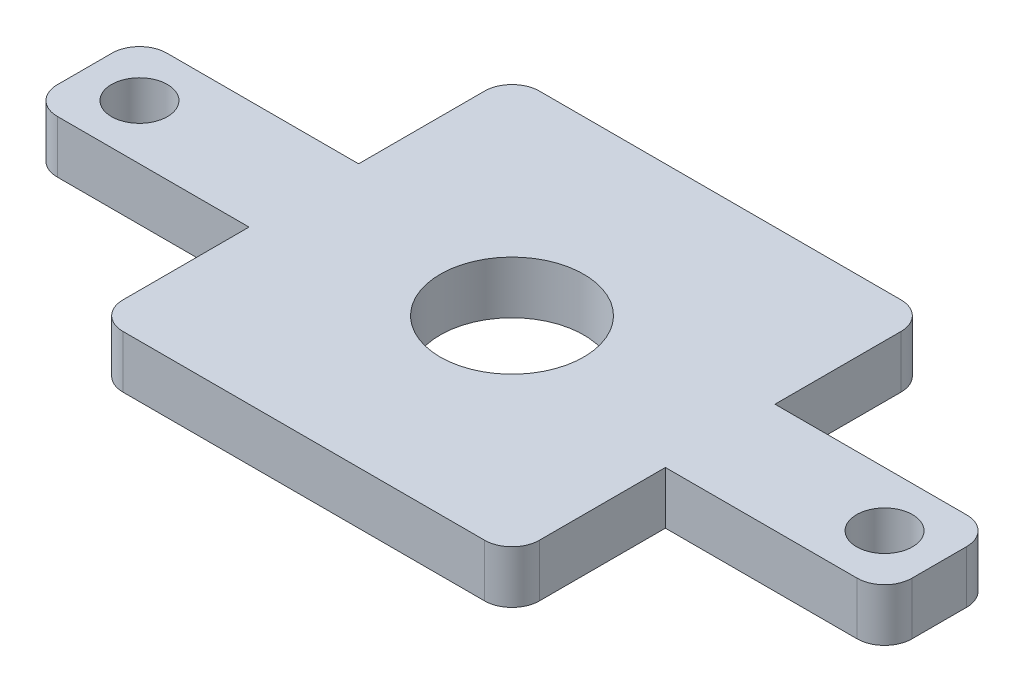
from build123d import *

# Parameters (mm, degrees)
SKETCH1_R           = 6.55
SKETCH1_R_2         = 2.55
BOSS_EXTRUDE1_DEPTH = 4.8
FILLET1_R           = 2.5


with BuildPart() as part:
    # Sketch1 → Boss-Extrude1 (new body)
    with BuildSketch(Plane(origin=(0, 0, 0), x_dir=(1, 0, 0), z_dir=(0, 1, 0))):
        Polygon((-19, -5), (-19, -19), (19, -19), (19, -5), (39, -5), (39, 5), (19, 5), (19, 19), (-19, 19), (-19, 5), (-39, 5), (-39, -5), align=None)
        Circle(SKETCH1_R, mode=Mode.SUBTRACT)
        with Locations((-34, 0)):
            Circle(SKETCH1_R_2, mode=Mode.SUBTRACT)
        with Locations((34, 0)):
            Circle(SKETCH1_R_2, mode=Mode.SUBTRACT)
    extrude(amount=BOSS_EXTRUDE1_DEPTH)

    # Fillet1
    fillet1_edges = [part.edges().sort_by_distance(p)[0] for p in [
        (39, 2.4, -5),
        (39, 2.4, 5),
        (-39, 2.4, -5),
        (-39, 2.4, 5),
        (19, 2.4, 19),
        (-19, 2.4, 19),
        (-19, 2.4, -19),
        (19, 2.4, -19),
    ]]
    fillet(fillet1_edges, radius=FILLET1_R)


solid = part.part
